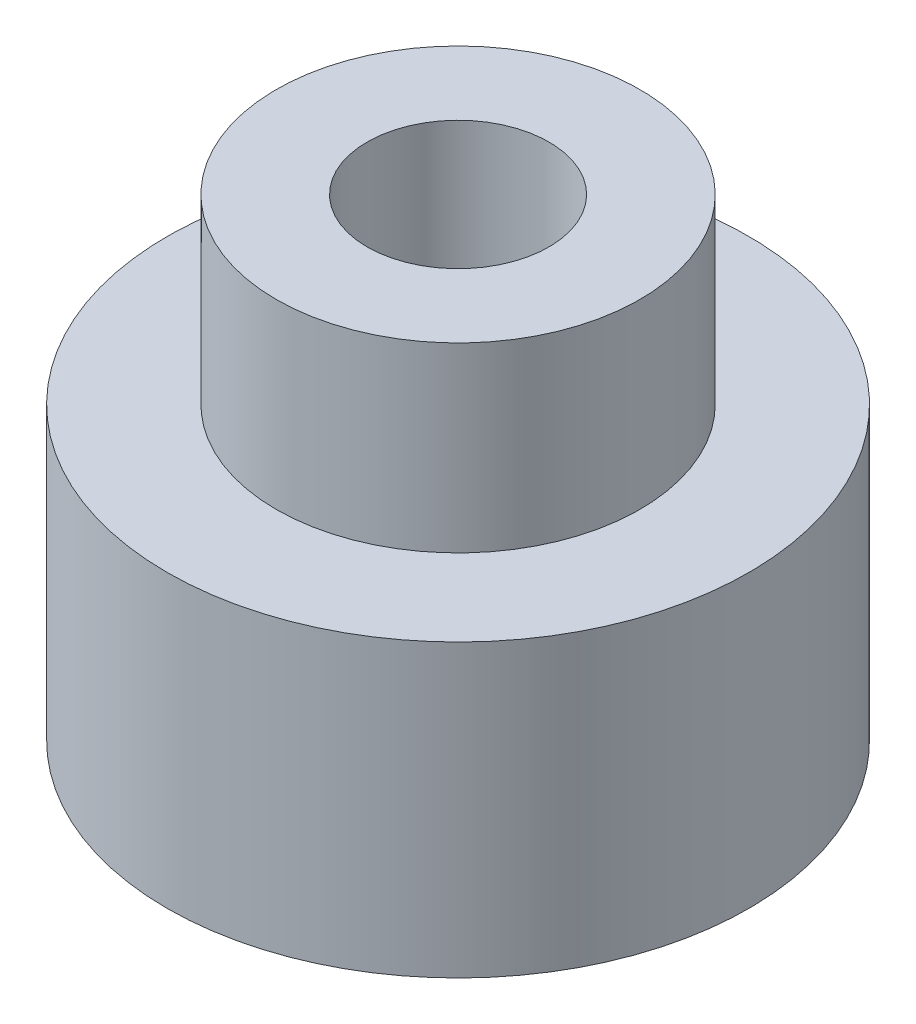
from build123d import *

# Parameters (mm, degrees)
ESQUISSE1_R             = 8
BOSS_EXTRU_1_DEPTH      = 8
ESQUISSE2_R             = 5
BOSS_EXTRU_2_DEPTH      = 5
ENL_V_MAT_EXTRU_1_REACH = 19.234
ESQUISSE3_R             = 2.5


with BuildPart() as part:
    # Esquisse1 → Boss.-Extru.1 (new body)
    with BuildSketch(Plane(origin=(0, 0, 0), x_dir=(1, 0, 0), z_dir=(0, 1, 0))):
        Circle(ESQUISSE1_R)
    extrude(amount=BOSS_EXTRU_1_DEPTH)

    # Esquisse2 → Boss.-Extru.2 (add)
    with BuildSketch(Plane(origin=(0, 8, 0), x_dir=(1, 0, 0), z_dir=(0, 1, 0))):
        Circle(ESQUISSE2_R)
    extrude(amount=BOSS_EXTRU_2_DEPTH)

    # Esquisse3 → Enlèv. mat.-Extru.1 (cut, up to next)
    with BuildSketch(Plane(origin=(0, 13, 0), x_dir=(1, 0, 0), z_dir=(0, 1, 0)), mode=Mode.PRIVATE) as enl_v_mat_extru_1_sk1:
        Circle(ESQUISSE3_R)
    enl_v_mat_extru_1_tool1 = extrude(enl_v_mat_extru_1_sk1.sketch, amount=-ENL_V_MAT_EXTRU_1_REACH, mode=Mode.PRIVATE) & part.part
    add(enl_v_mat_extru_1_tool1.solids().sort_by_distance((0, 13, 0))[0], mode=Mode.SUBTRACT)


solid = part.part
